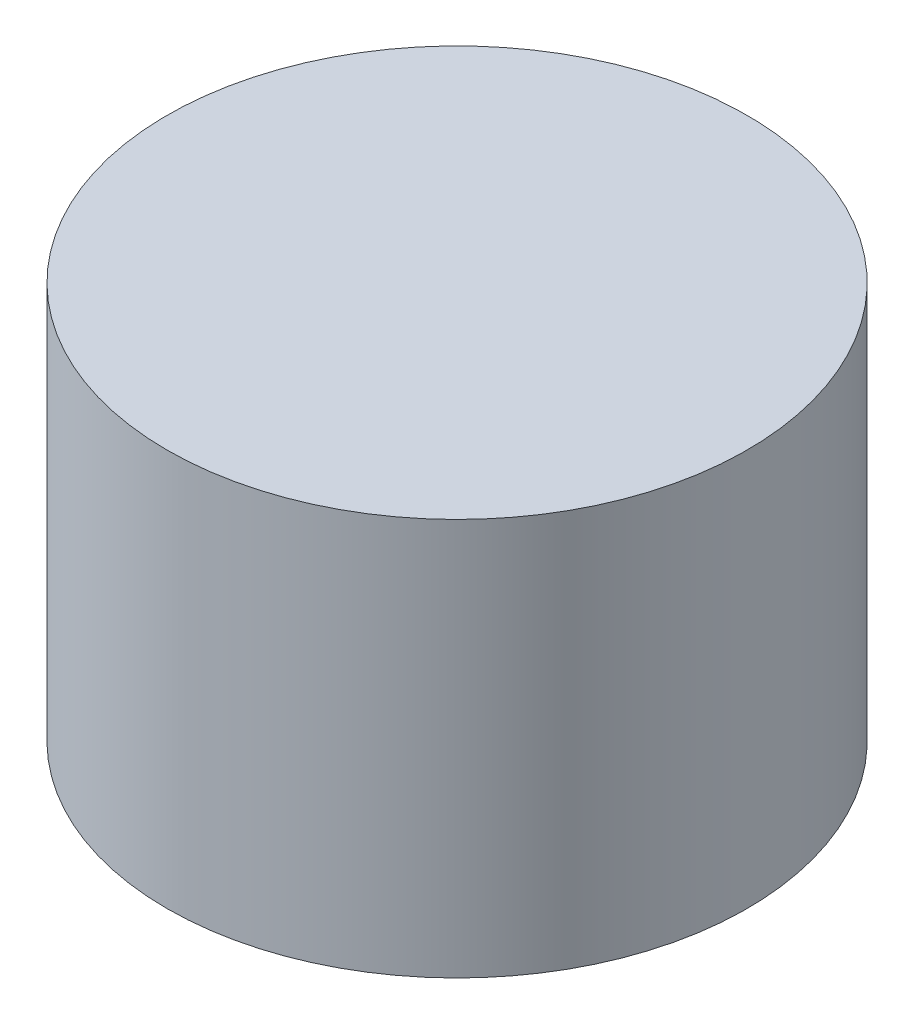
from build123d import *

# Parameters (mm, degrees)
SKETCH3_R           = 23.075
BOSS_EXTRUDE3_DEPTH = 31.6
SKETCH4_R           = 22.075
CUT_EXTRUDE1_DEPTH  = 30.6


with BuildPart() as part:
    # Sketch3 → Boss-Extrude3 (new body)
    with BuildSketch(Plane(origin=(0, 0, 0), x_dir=(1, 0, 0), z_dir=(0, 1, 0))):
        Circle(SKETCH3_R)
    extrude(amount=BOSS_EXTRUDE3_DEPTH)

    # Sketch4 → Cut-Extrude1 (cut)
    with BuildSketch(Plane.XZ):
        Circle(SKETCH4_R)
    extrude(amount=-CUT_EXTRUDE1_DEPTH, mode=Mode.SUBTRACT)


solid = part.part
